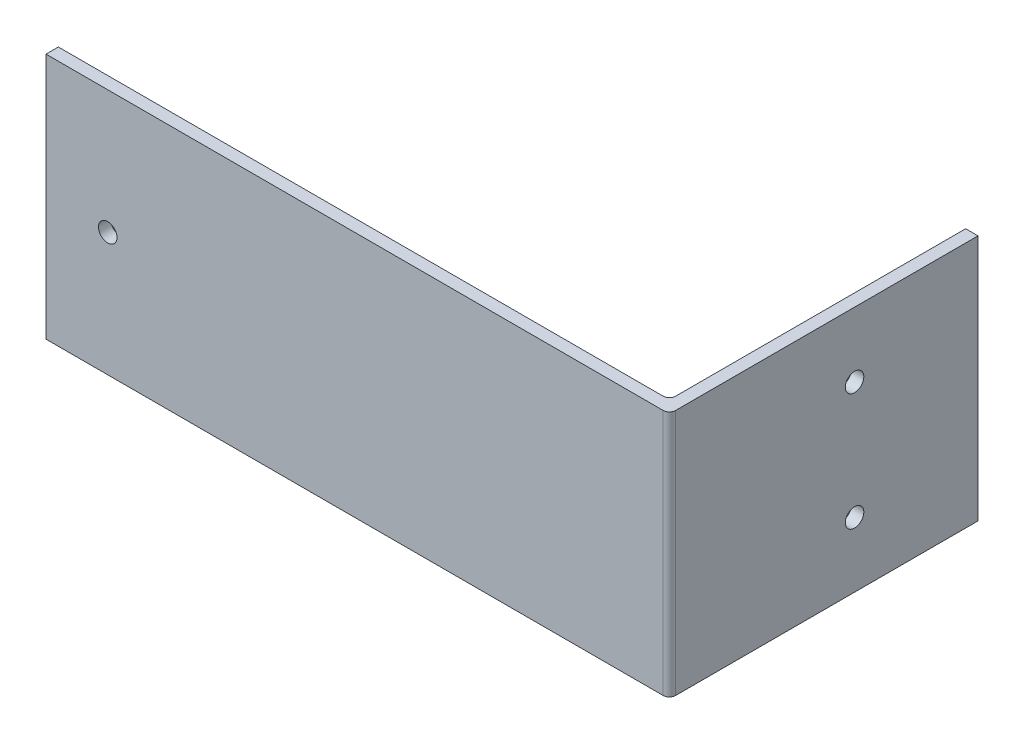
from build123d import *

# Parameters (mm, degrees)
SKETCH1_W           = 100
SKETCH1_H           = 40
SKETCH1_R           = 1.5
BOSS_EXTRUDE1_DEPTH = 2
SKETCH2_W           = 2
SKETCH2_H           = 40
BOSS_EXTRUDE3_DEPTH = 50
FILLET2_R           = 1
SKETCH3_R           = 1.5
CUT_EXTRUDE1_DEPTH  = 10


with BuildPart() as part:
    # Sketch1 → Boss-Extrude1 (new body)
    with BuildSketch(Plane.XY):
        with Locations((50, 20)):
            Rectangle(SKETCH1_W, SKETCH1_H)
        with Locations((10, 20)):
            Circle(SKETCH1_R, mode=Mode.SUBTRACT)
    extrude(amount=BOSS_EXTRUDE1_DEPTH)

    # Sketch2 → Boss-Extrude3 (add)
    with BuildSketch(Plane.XY.offset(2)):
        with Locations((100, 20)):
            Rectangle(SKETCH2_W, SKETCH2_H)
    extrude(amount=-BOSS_EXTRUDE3_DEPTH)

    # Fillet2
    fillet2_edges = [part.edges().sort_by_distance(p)[0] for p in [
        (101, 20, 2),
        (99, 20, 0),
    ]]
    fillet(fillet2_edges, radius=FILLET2_R)

    # Sketch3 → Cut-Extrude1 (cut)
    with BuildSketch(Plane(origin=(101, 0, 0), x_dir=(0, 0, -1), z_dir=(1, 0, 0))):
        with Locations((28, 10.5)):
            Circle(SKETCH3_R)
        with Locations((28, 29.5)):
            Circle(SKETCH3_R)
    extrude(amount=-CUT_EXTRUDE1_DEPTH, mode=Mode.SUBTRACT)


solid = part.part
